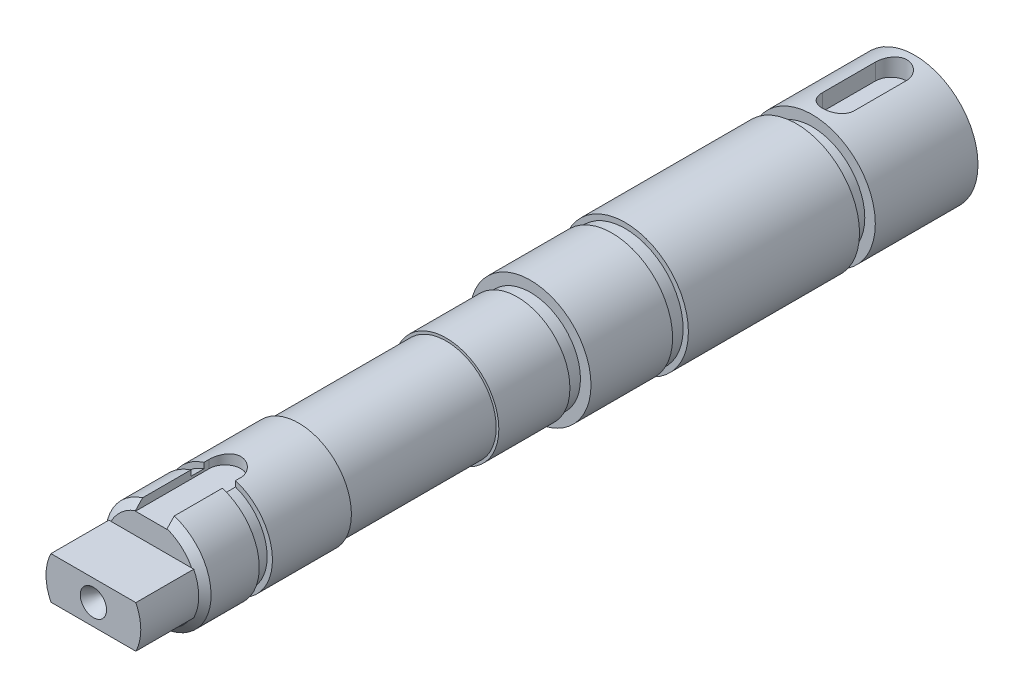
from build123d import *

# Parameters (mm, degrees)
SKETCH_1_R            = 12
EXTRUDE_1_DEPTH       = 55
CUT_EXTRUDE_START     = 19.5
SKETCH_2_OUTSIDE_W    = 38.926
SKETCH_2_OUTSIDE_H    = 38.926
SKETCH_2_OUTSIDE_R    = 10
CUT_EXTRUDE_1_DEPTH   = 3
SKETCH_3_R            = 11.5
EXTRUDE_2_DEPTH       = 18
SKETCH_4_OUTSIDE_W    = 42.1
SKETCH_4_OUTSIDE_H    = 42.1
SKETCH_4_OUTSIDE_R    = 11
CUT_EXTRUDE_2_DEPTH   = 2.5
SKETCH_5_R            = 10
EXTRUDE_3_DEPTH       = 16
SKETCH_6_OUTSIDE_W    = 45.05
SKETCH_6_OUTSIDE_H    = 45.05
SKETCH_6_OUTSIDE_R    = 9.5
CUT_EXTRUDE_3_DEPTH   = 2.5
SKETCH_7_R            = 9.5
EXTRUDE_4_DEPTH       = 28
SKETCH_9_R            = 10
EXTRUDE_6_DEPTH       = 15
SKETCH_10_R           = 10
EXTRUDE_7_DEPTH       = 24
SKETCH_11_OUTSIDE_W   = 57.93
SKETCH_11_OUTSIDE_H   = 57.93
SKETCH_11_OUTSIDE_R   = 9
CUT_EXTRUDE_4_DEPTH   = 11
CUT_EXTRUDE_START_2   = -21.5
SKETCH_12_OUTSIDE_W   = 57.93
SKETCH_12_OUTSIDE_H   = 57.93
SKETCH_12_OUTSIDE_R   = 9
CUT_EXTRUDE_5_DEPTH   = 2.5
CUT_EXTRUDE_8_DEPTH   = 157.920361967
CUT_EXTRUDE_START_3   = 8
CUT_EXTRUDE_9_DEPTH   = 149.920361967
CUT_EXTRUDE_START_4   = 8.5
CUT_EXTRUDE_10_DEPTH  = 149.420361967
F_2_0MM_1_D           = 2
F_2_0MM_1_DEPTH       = 5
F_2_0MM_1_CSINK_D     = 5
F_2_0MM_1_CSINK_ANGLE = 60
F_2_0MM_1_TIP         = 0.600860619
F_2_0MM_4_D           = 2
F_2_0MM_4_DEPTH       = 5
F_2_0MM_4_CSINK_D     = 5
F_2_0MM_4_CSINK_ANGLE = 60
F_2_0MM_4_TIP         = 0.600860619


# Read off the part's stored shape, not the designer's step: M20 机械螺纹 螺柱1
with BuildPart() as part:
    # 草图1 → 凸台-拉伸1 (new body)
    with BuildSketch(Plane.XY):
        Circle(SKETCH_1_R)
    extrude(amount=EXTRUDE_1_DEPTH)

    # 草图2 outside → 切除-拉伸1 (cut)
    with BuildSketch(Plane.XY.offset(CUT_EXTRUDE_START)):
        Rectangle(SKETCH_2_OUTSIDE_W, SKETCH_2_OUTSIDE_H)
        Circle(SKETCH_2_OUTSIDE_R, mode=Mode.SUBTRACT)
    extrude(amount=CUT_EXTRUDE_1_DEPTH, mode=Mode.SUBTRACT)

    # 草图3 → 凸台-拉伸2 (add)
    with BuildSketch(Plane.XY.offset(55)):
        Circle(SKETCH_3_R)
    extrude(amount=EXTRUDE_2_DEPTH)

    # 草图4 outside → 切除-拉伸2 (cut)
    with BuildSketch(Plane.XY.offset(55)):
        Rectangle(SKETCH_4_OUTSIDE_W, SKETCH_4_OUTSIDE_H)
        Circle(SKETCH_4_OUTSIDE_R, mode=Mode.SUBTRACT)
    extrude(amount=CUT_EXTRUDE_2_DEPTH, mode=Mode.SUBTRACT)

    # 草图5 → 凸台-拉伸3 (add)
    with BuildSketch(Plane.XY.offset(73)):
        Circle(SKETCH_5_R)
    extrude(amount=EXTRUDE_3_DEPTH)

    # 草图6 outside → 切除-拉伸3 (cut)
    with BuildSketch(Plane.XY.offset(73)):
        Rectangle(SKETCH_6_OUTSIDE_W, SKETCH_6_OUTSIDE_H)
        Circle(SKETCH_6_OUTSIDE_R, mode=Mode.SUBTRACT)
    extrude(amount=CUT_EXTRUDE_3_DEPTH, mode=Mode.SUBTRACT)

    # 草图7 → 凸台-拉伸4 (add)
    with BuildSketch(Plane.XY.offset(89)):
        Circle(SKETCH_7_R)
    extrude(amount=EXTRUDE_4_DEPTH)

    # 草图9 → 凸台-拉伸6 (add)
    with BuildSketch(Plane.XY.offset(117)):
        Circle(SKETCH_9_R)
    extrude(amount=EXTRUDE_6_DEPTH)

    # 草图10 → 凸台-拉伸7 (add)
    with BuildSketch(Plane.XY.offset(132)):
        Circle(SKETCH_10_R)
    extrude(amount=EXTRUDE_7_DEPTH)

    # 草图11 outside → 切除-拉伸4 (cut)
    with BuildSketch(Plane.XY.offset(156)):
        Rectangle(SKETCH_11_OUTSIDE_W, SKETCH_11_OUTSIDE_H)
        Circle(SKETCH_11_OUTSIDE_R, mode=Mode.SUBTRACT)
    extrude(amount=-CUT_EXTRUDE_4_DEPTH, mode=Mode.SUBTRACT)

    # 草图12 outside → 切除-拉伸5 (cut)
    with BuildSketch(Plane.XY.offset(156).offset(CUT_EXTRUDE_START_2)):
        Rectangle(SKETCH_12_OUTSIDE_W, SKETCH_12_OUTSIDE_H)
        Circle(SKETCH_12_OUTSIDE_R, mode=Mode.SUBTRACT)
    extrude(amount=-CUT_EXTRUDE_5_DEPTH, mode=Mode.SUBTRACT)

    # M20 机械螺纹 螺柱1 outline → M20 机械螺纹 螺柱1 (revolve, cut)
    with BuildSketch(Plane.XZ):
        Polygon((10, 145), (8.647, 145), (10, 143.647), align=None)
    revolve(axis=Axis((0, 0, 0), (0, 0, 1)), mode=Mode.SUBTRACT)

    # 草图14 → 切除-拉伸8 (cut, symmetric)
    with BuildSketch(Plane(origin=(0, 0, 0), x_dir=(0, 0, -1), z_dir=(1, 0, 0))):
        Polygon((-479.636732543, 4), (-156, 4), (-145, 4), (-145, 14.592114555), (-145, 338.228847098), (-602.412263469, 796.199326311), (-937.048996012, 461.970479214), align=None)
    cut_extrude_8 = extrude(amount=CUT_EXTRUDE_8_DEPTH, both=True, mode=Mode.SUBTRACT)

    # 镜向1: 切除-拉伸8 across plane
    add(cut_extrude_8.mirror(Plane.ZX), mode=Mode.SUBTRACT)

    # 草图15 → 切除-拉伸9 (cut, through all)
    with BuildSketch(Plane(origin=(0, 0, 0), x_dir=(1, 0, 0), z_dir=(0, 1, 0)).offset(CUT_EXTRUDE_START_3)):
        with BuildLine():
            Line((-3, -145), (-3, -131))
            ThreePointArc((-3, -131), (0, -128), (3, -131))
            Line((3, -131), (3, -145))
            ThreePointArc((3, -145), (0, -148), (-3, -145))
        make_face()
    extrude(amount=CUT_EXTRUDE_9_DEPTH, mode=Mode.SUBTRACT)

    # 草图17 → 切除-拉伸10 (cut, through all)
    with BuildSketch(Plane(origin=(0, 0, 0), x_dir=(1, 0, 0), z_dir=(0, 1, 0)).offset(CUT_EXTRUDE_START_4)):
        with BuildLine():
            Line((3, -4.5), (3, -14.5))
            ThreePointArc((3, -14.5), (0, -17.5), (-3, -14.5))
            Line((-3, -14.5), (-3, -4.5))
            ThreePointArc((-3, -4.5), (0, -1.5), (3, -4.5))
        make_face()
    extrude(amount=CUT_EXTRUDE_10_DEPTH, mode=Mode.SUBTRACT)

    # Ø2.0mm 暗销孔1
    with Locations(Plane(origin=(0, 0, 0), x_dir=(-1, 0, 0), z_dir=(0, 0, -1))):
        with Locations((0, 0)):
            CounterSinkHole(F_2_0MM_1_D / 2, F_2_0MM_1_CSINK_D / 2, depth=F_2_0MM_1_DEPTH, counter_sink_angle=F_2_0MM_1_CSINK_ANGLE)
            with Locations((0, 0, -(F_2_0MM_1_DEPTH + F_2_0MM_1_TIP / 2))):  # 118° drill point
                Cone(0, F_2_0MM_1_D / 2, F_2_0MM_1_TIP, mode=Mode.SUBTRACT)

    # Ø2.0mm 暗销孔4
    with Locations(Plane.XY.offset(156)):
        with Locations((0, 0)):
            CounterSinkHole(F_2_0MM_4_D / 2, F_2_0MM_4_CSINK_D / 2, depth=F_2_0MM_4_DEPTH, counter_sink_angle=F_2_0MM_4_CSINK_ANGLE)
            with Locations((0, 0, -(F_2_0MM_4_DEPTH + F_2_0MM_4_TIP / 2))):  # 118° drill point
                Cone(0, F_2_0MM_4_D / 2, F_2_0MM_4_TIP, mode=Mode.SUBTRACT)


solid = part.part
